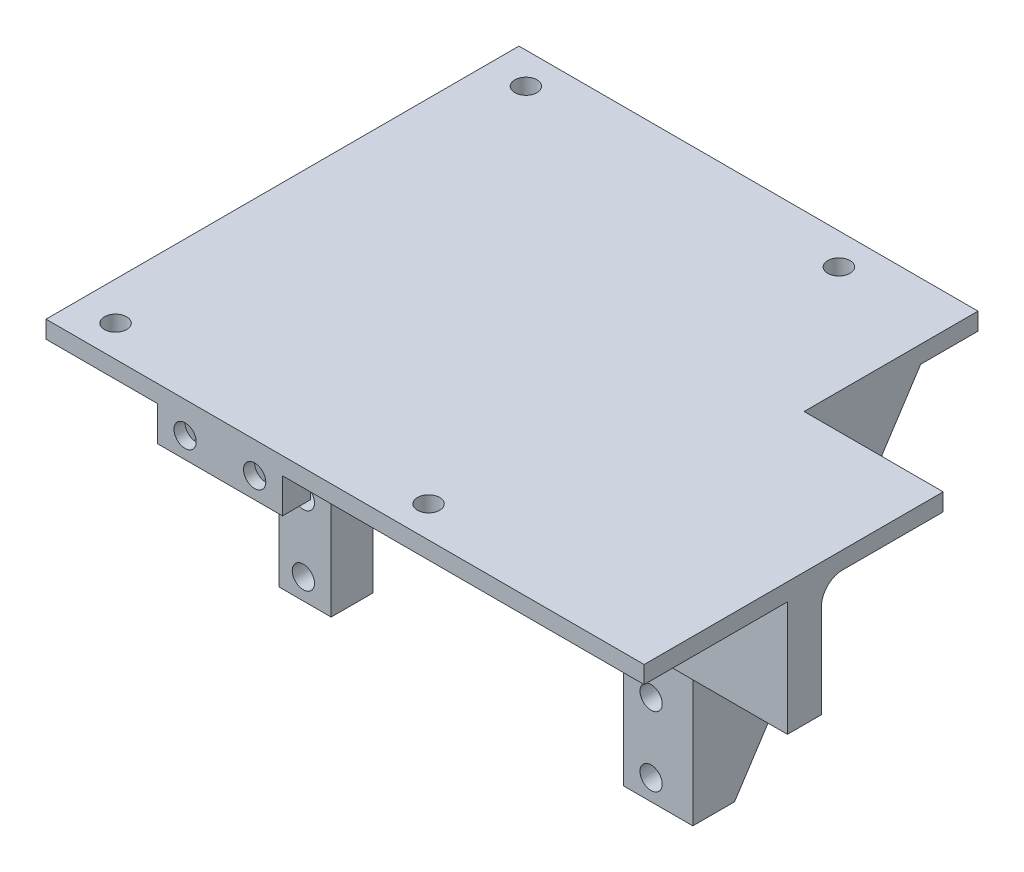
from build123d import *

# Parameters (mm, degrees)
ORTHOGONAL_START                              = -15
ORTHOGONAL_CHASSIS_PLATE_PRIMARY_PROFILE_W    = 66
ORTHOGONAL_CHASSIS_PLATE_PRIMARY_PROFILE_H    = 4
ORTHOGONAL_CHASSIS_PLATE_PRIMARY_DEPTH        = 25.1
ORTHOGONAL_START_2                            = 10
ORTHOGONAL_CHASSIS_PLATE_GUIDE_SIDE_PROF_W    = 109
ORTHOGONAL_CHASSIS_PLATE_GUIDE_SIDE_PROF_H    = 4
ORTHOGONAL_CHASSIS_PLATE_GUIDE_SIDE_DEPTH     = 43
HORIZONTAL_START                              = 20
HORIZONTAL_SERVO_SEAT_UPRIGHTS_PROFILE_W      = 7.5
HORIZONTAL_SERVO_SEAT_UPRIGHTS_PROFILE_H      = 37.1
HORIZONTAL_SERVO_SEAT_UPRIGHTS_PROFILE_W_2    = 10
HORIZONTAL_SERVO_SEAT_UPRIGHTS_DEPTH          = 6
SIDE_START                                    = 27.5
SIDE_MOUNTING_FACE_FOR_MGN7_RAIL_PROFILE_W    = 100
SIDE_MOUNTING_FACE_FOR_MGN7_RAIL_PROFILE_H    = 16.6
SIDE_MOUNTING_FACE_FOR_MGN7_RAIL_DEPTH        = 4.9
HORIZONTAL_START_2                            = 49
HORIZONTAL_LIMIT_BRACKET_FOOT_SUPPORT_PR_W    = 18
HORIZONTAL_LIMIT_BRACKET_FOOT_SUPPORT_PR_H    = 5.1
HORIZONTAL_LIMIT_BRACKET_FOOT_SUPPORT_DEPTH   = 4
CHASSIS_START                                 = 28.9
CHASSIS_MOUNTING_HOLE_LAYOUT_45_X_41_2_R      = 1.6
CHASSIS_MOUNTING_HOLE_LAYOUT_45_X_41_MM_DEPTH = 4.2
SERVO_START                                   = 19.9
SERVO_MOUNT_50_X_10_MM_PITCH_PROFILE_R        = 1.6
SERVO_MOUNT_50_X_10_MM_PITCH_DEPTH            = 6.2
GUIDE_START                                   = 27.45
GUIDE_M2_MOUNTING_PILOTS_15_MM_PITCH_PRO_R    = 1.05
GUIDE_M2_MOUNTING_PILOTS_15_MM_PITCH_DEPTH    = 5.05
STOP_START                                    = 48.9
STOP_MOUNTING_TWO_M3_PILOTS_10_MM_PI_2_R      = 1.6
STOP_MOUNTING_TWO_M3_PILOTS_10_MM_PITCH_DEPTH = 4.2
FILLET_2_R                                    = 3
SKETCH_3_W                                    = 18
SKETCH_3_H                                    = 3
CUT_EXTRUDE_1_DEPTH                           = 2
CUT_EXTRUDE_2_DEPTH                           = 2.4
EXTRUDE_3_DEPTH                               = 7.5
EXTRUDE_4_DEPTH                               = 10
FILLET_3_R                                    = 5
SKETCH_7_W                                    = 109
SKETCH_7_H                                    = 1.5
CUT_EXTRUDE_3_DEPTH                           = 80
SKETCH_8_W                                    = 23
SKETCH_8_H                                    = 43
CUT_EXTRUDE_4_DEPTH                           = 30
RAISE_START                                   = 20
RAISE_SERVO_MOUNTING_TABS_BY_4_10_MM_PRO_W    = 7.5
RAISE_SERVO_MOUNTING_TABS_BY_4_10_MM_PRO_H    = 5.1
RAISE_SERVO_MOUNTING_TABS_BY_4_10_MM_PRO_W_2  = 10
RAISE_SERVO_MOUNTING_TABS_BY_4_10_MM_DEPTH    = 6
FILL_START                                    = 20
FILL_ORIGINAL_SERVO_HOLES_PROFILE_R           = 1.65
FILL_ORIGINAL_SERVO_HOLES_DEPTH               = 6
SERVO_MOUNTING_HOLES_RAISED_4_10_MM_PROF_R    = 1.6
SERVO_MOUNTING_HOLES_RAISED_4_10_MM_DEPTH     = 6.2
EXTRUDE_5_DEPTH                               = 2


with BuildPart() as part:
    # Orthogonal chassis plate primary profile → Orthogonal chassis plate primary (new body)
    with BuildSketch(Plane.XY.offset(ORTHOGONAL_START)):
        with Locations((8, 31)):
            Rectangle(ORTHOGONAL_CHASSIS_PLATE_PRIMARY_PROFILE_W, ORTHOGONAL_CHASSIS_PLATE_PRIMARY_PROFILE_H)
    extrude(amount=ORTHOGONAL_CHASSIS_PLATE_PRIMARY_DEPTH)

    # Orthogonal chassis plate guide side profile → Orthogonal chassis plate guide side (add)
    with BuildSketch(Plane.XY.offset(ORTHOGONAL_START_2)):
        with Locations((29.5, 31)):
            Rectangle(ORTHOGONAL_CHASSIS_PLATE_GUIDE_SIDE_PROF_W, ORTHOGONAL_CHASSIS_PLATE_GUIDE_SIDE_PROF_H)
    extrude(amount=ORTHOGONAL_CHASSIS_PLATE_GUIDE_SIDE_DEPTH)

    # Horizontal servo seat uprights profile → Horizontal servo seat uprights (add)
    with BuildSketch(Plane.XY.offset(HORIZONTAL_START)):
        with Locations((-14.75, 10.55)):
            Rectangle(HORIZONTAL_SERVO_SEAT_UPRIGHTS_PROFILE_W, HORIZONTAL_SERVO_SEAT_UPRIGHTS_PROFILE_H)
        with Locations((36, 10.55)):
            Rectangle(HORIZONTAL_SERVO_SEAT_UPRIGHTS_PROFILE_W_2, HORIZONTAL_SERVO_SEAT_UPRIGHTS_PROFILE_H)
    extrude(amount=HORIZONTAL_SERVO_SEAT_UPRIGHTS_DEPTH)

    # Side mounting face for MGN7 rail profile → Side mounting face for MGN7 rail (add)
    with BuildSketch(Plane.XY.offset(SIDE_START)):
        with Locations((33, 20.8)):
            Rectangle(SIDE_MOUNTING_FACE_FOR_MGN7_RAIL_PROFILE_W, SIDE_MOUNTING_FACE_FOR_MGN7_RAIL_PROFILE_H)
    extrude(amount=SIDE_MOUNTING_FACE_FOR_MGN7_RAIL_DEPTH)

    # Horizontal limit bracket foot support profile → Horizontal limit bracket foot support (add)
    with BuildSketch(Plane.XY.offset(HORIZONTAL_START_2)):
        with Locations((0, 26.55)):
            Rectangle(HORIZONTAL_LIMIT_BRACKET_FOOT_SUPPORT_PR_W, HORIZONTAL_LIMIT_BRACKET_FOOT_SUPPORT_PR_H)
    extrude(amount=HORIZONTAL_LIMIT_BRACKET_FOOT_SUPPORT_DEPTH)

    # Chassis mounting hole layout 45 x 41 2 → Chassis mounting hole layout 45 x 41 mm (cut)
    with BuildSketch(Plane(origin=(0, 0, 0), x_dir=(1, 0, 0), z_dir=(0, 1, 0)).offset(CHASSIS_START)):
        with Locations(Location((-19.5, 10.5, 0), (0, 0, 90))):
            Circle(CHASSIS_MOUNTING_HOLE_LAYOUT_45_X_41_2_R)
        with Locations(Location((-19.5, -48.5, 0), (0, 0, 90))):
            Circle(CHASSIS_MOUNTING_HOLE_LAYOUT_45_X_41_2_R)
        with Locations(Location((25.5, 10.5, 0), (0, 0, 90))):
            Circle(CHASSIS_MOUNTING_HOLE_LAYOUT_45_X_41_2_R)
        with Locations(Location((25.5, -48.5, 0), (0, 0, 90))):
            Circle(CHASSIS_MOUNTING_HOLE_LAYOUT_45_X_41_2_R)
        with Locations(Location((70.5, -48.5, 0), (0, 0, 90))):
            Circle(CHASSIS_MOUNTING_HOLE_LAYOUT_45_X_41_2_R)
    extrude(amount=CHASSIS_MOUNTING_HOLE_LAYOUT_45_X_41_MM_DEPTH, mode=Mode.SUBTRACT)

    # Servo mount 50 x 10 mm pitch profile → Servo mount 50 x 10 mm pitch (cut)
    with BuildSketch(Plane.XY.offset(SERVO_START)):
        with Locations(Location((-15, -5, 0), (0, 0, 180))):
            Circle(SERVO_MOUNT_50_X_10_MM_PITCH_PROFILE_R)
        with Locations(Location((-15, 5, 0), (0, 0, 180))):
            Circle(SERVO_MOUNT_50_X_10_MM_PITCH_PROFILE_R)
        with Locations(Location((35, -5, 0), (0, 0, 180))):
            Circle(SERVO_MOUNT_50_X_10_MM_PITCH_PROFILE_R)
        with Locations(Location((35, 5, 0), (0, 0, 180))):
            Circle(SERVO_MOUNT_50_X_10_MM_PITCH_PROFILE_R)
    extrude(amount=SERVO_MOUNT_50_X_10_MM_PITCH_DEPTH, mode=Mode.SUBTRACT)

    # Guide M2 mounting pilots 15 mm pitch profile → Guide M2 mounting pilots 15 mm pitch (cut)
    with BuildSketch(Plane.XY.offset(GUIDE_START)):
        with Locations((-12, 19)):
            Circle(GUIDE_M2_MOUNTING_PILOTS_15_MM_PITCH_PRO_R)
        with Locations((3, 19)):
            Circle(GUIDE_M2_MOUNTING_PILOTS_15_MM_PITCH_PRO_R)
        with Locations((18, 19)):
            Circle(GUIDE_M2_MOUNTING_PILOTS_15_MM_PITCH_PRO_R)
        with Locations((33, 19)):
            Circle(GUIDE_M2_MOUNTING_PILOTS_15_MM_PITCH_PRO_R)
        with Locations((48, 19)):
            Circle(GUIDE_M2_MOUNTING_PILOTS_15_MM_PITCH_PRO_R)
        with Locations((63, 19)):
            Circle(GUIDE_M2_MOUNTING_PILOTS_15_MM_PITCH_PRO_R)
        with Locations((78, 19)):
            Circle(GUIDE_M2_MOUNTING_PILOTS_15_MM_PITCH_PRO_R)
    extrude(amount=GUIDE_M2_MOUNTING_PILOTS_15_MM_PITCH_DEPTH, mode=Mode.SUBTRACT)

    # Stop mounting two M3 pilots 10 mm pi 2 → Stop mounting two M3 pilots 10 mm pitch (cut)
    with BuildSketch(Plane.XY.offset(STOP_START)):
        with Locations((-5, 27)):
            Circle(STOP_MOUNTING_TWO_M3_PILOTS_10_MM_PI_2_R)
        with Locations((5, 27)):
            Circle(STOP_MOUNTING_TWO_M3_PILOTS_10_MM_PI_2_R)
    extrude(amount=STOP_MOUNTING_TWO_M3_PILOTS_10_MM_PITCH_DEPTH, mode=Mode.SUBTRACT)

    # 圆角2
    # the kernel refuses this fillet: 3 mm, written as the material it adds along each edge
    with BuildSketch(Plane(origin=(-17, 29, 27.5), x_dir=(0, 0, -1), z_dir=(1, 0, 0))) as fillet_2_piece_1:
        with BuildLine():
            CenterArc((FILLET_2_R, -FILLET_2_R), FILLET_2_R, 90, 90)
            Line((0, -FILLET_2_R), (0, 0))
            Line((0, 0), (FILLET_2_R, 0))
        make_face()
    extrude(amount=100)

    # 草图3 → 切除-拉伸1 (cut)
    with BuildSketch(Plane(origin=(0, 29, 0), x_dir=(-1, 0, 0), z_dir=(0, -1, 0))):
        with Locations((0, -47.5)):
            Rectangle(SKETCH_3_W, SKETCH_3_H)
    extrude(amount=-CUT_EXTRUDE_1_DEPTH, mode=Mode.SUBTRACT)

    # 草图4 → 切除-拉伸2 (cut)
    with BuildSketch(Plane(origin=(0, 0, 49), x_dir=(-1, 0, 0), z_dir=(0, 0, -1))):
        Polygon((-3.267949192, 30), (-6.732050808, 30), (-8.464101615, 27), (-6.732050808, 24), (-3.267949192, 24), (-1.535898385, 27), align=None)
        Polygon((6.732050808, 30), (3.267949192, 30), (1.535898385, 27), (3.267949192, 24), (6.732050808, 24), (8.464101615, 27), align=None)
    extrude(amount=-CUT_EXTRUDE_2_DEPTH, mode=Mode.SUBTRACT)

    # 草图5 → 凸台-拉伸3 (add)
    with BuildSketch(Plane(origin=(-11, 0, 0), x_dir=(0, 0, -1), z_dir=(1, 0, 0))):
        Polygon((-20, 29), (5, 29), (-20, 9), align=None)
    extrude(amount=-EXTRUDE_3_DEPTH)

    # 草图6 → 凸台-拉伸4 (add)
    with BuildSketch(Plane.ZY.offset(-31)):
        Polygon((20, 29), (-5, 29), (20, 9), align=None)
    extrude(amount=-EXTRUDE_4_DEPTH)

    # 圆角3
    fillet_3_edges = [part.edges().sort_by_distance(p)[0] for p in [
        (-14.75, 9, 20),
        (-14.75, 29, -5),
        (36, 9, 20),
        (36, 29, -5),
    ]]
    fillet(fillet_3_edges, radius=FILLET_3_R)

    # 草图7 → 切除-拉伸3 (cut)
    with BuildSketch(Plane.XY.offset(53)):
        with Locations((29.5, 32.25)):
            Rectangle(SKETCH_7_W, SKETCH_7_H)
    extrude(amount=-CUT_EXTRUDE_3_DEPTH, mode=Mode.SUBTRACT)

    # 草图8 → 切除-拉伸4 (cut)
    with BuildSketch(Plane(origin=(0, 31.5, 0), x_dir=(1, 0, 0), z_dir=(0, 1, 0))):
        with Locations((72.5, -31.5)):
            Rectangle(SKETCH_8_W, SKETCH_8_H)
    extrude(amount=-CUT_EXTRUDE_4_DEPTH, mode=Mode.SUBTRACT)

    # Raise servo mounting tabs by 4.10 mm profile → Raise servo mounting tabs by 4.10 mm (add)
    with BuildSketch(Plane.XY.offset(RAISE_START)):
        with Locations((-14.75, -9.55)):
            Rectangle(RAISE_SERVO_MOUNTING_TABS_BY_4_10_MM_PRO_W, RAISE_SERVO_MOUNTING_TABS_BY_4_10_MM_PRO_H)
        with Locations((36, -9.55)):
            Rectangle(RAISE_SERVO_MOUNTING_TABS_BY_4_10_MM_PRO_W_2, RAISE_SERVO_MOUNTING_TABS_BY_4_10_MM_PRO_H)
    extrude(amount=RAISE_SERVO_MOUNTING_TABS_BY_4_10_MM_DEPTH)

    # Fill original servo holes profile → Fill original servo holes (add)
    with BuildSketch(Plane.XY.offset(FILL_START)):
        with Locations((-15, -5)):
            Circle(FILL_ORIGINAL_SERVO_HOLES_PROFILE_R)
        with Locations((-15, 5)):
            Circle(FILL_ORIGINAL_SERVO_HOLES_PROFILE_R)
        with Locations((35, -5)):
            Circle(FILL_ORIGINAL_SERVO_HOLES_PROFILE_R)
        with Locations((35, 5)):
            Circle(FILL_ORIGINAL_SERVO_HOLES_PROFILE_R)
    extrude(amount=FILL_ORIGINAL_SERVO_HOLES_DEPTH)

    # Servo mounting holes raised 4.10 mm profile → Servo mounting holes raised 4.10 mm (cut)
    with BuildSketch(Plane.XY.offset(SERVO_START)):
        with Locations(Location((-15, -9.1, 0), (0, 0, 180))):
            Circle(SERVO_MOUNTING_HOLES_RAISED_4_10_MM_PROF_R)
        with Locations(Location((-15, 0.9, 0), (0, 0, 180))):
            Circle(SERVO_MOUNTING_HOLES_RAISED_4_10_MM_PROF_R)
        with Locations(Location((35, -9.1, 0), (0, 0, 180))):
            Circle(SERVO_MOUNTING_HOLES_RAISED_4_10_MM_PROF_R)
        with Locations(Location((35, 0.9, 0), (0, 0, 180))):
            Circle(SERVO_MOUNTING_HOLES_RAISED_4_10_MM_PROF_R)
    extrude(amount=SERVO_MOUNTING_HOLES_RAISED_4_10_MM_DEPTH, mode=Mode.SUBTRACT)

    # 草图9 → 凸台-拉伸5 (add)
    with BuildSketch(Plane(origin=(41, 0, 0), x_dir=(0, 0, -1), z_dir=(1, 0, 0))):
        Polygon((-24.5, 29), (6.753905297, 29), (-20, -12.1), align=None)
    extrude(amount=-EXTRUDE_5_DEPTH)


solid = part.part
